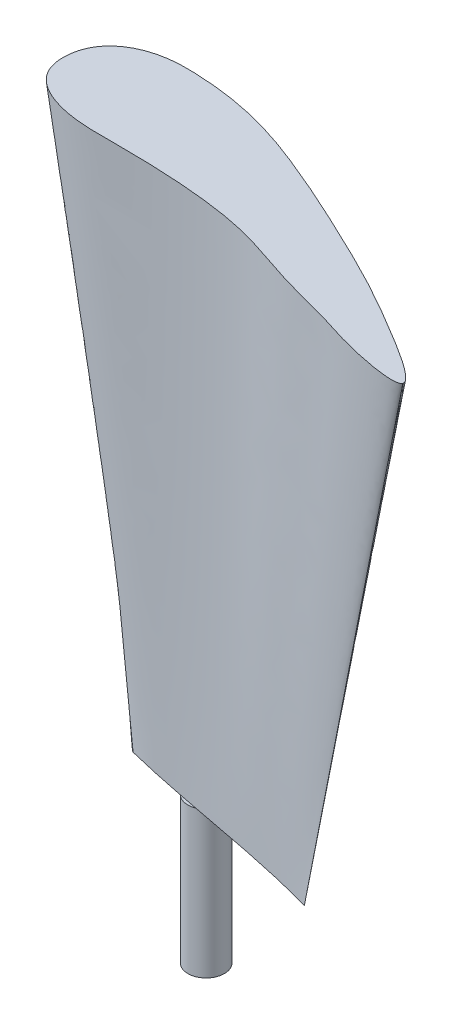
from build123d import *

# Parameters (mm, degrees)
SKETCH1_R           = 0.5
BOSS_EXTRUDE1_DEPTH = 4


with BuildPart() as part:
    # Sketch1 → Boss-Extrude1 (new body)
    with BuildSketch(Plane(origin=(0, 0, 0), x_dir=(1, 0, 0), z_dir=(0, 1, 0))):
        with Locations(Location((0, 0, 0), (0, 0, 270))):
            Circle(SKETCH1_R)
    extrude(amount=BOSS_EXTRUDE1_DEPTH)

    # Loft1: read off the stored shape, not the designer's step
    # Loft1: loft between two sections, ruled curve by curve
    loft1_from = [
        Edge.make_bspline([(3.982375398, 4, 1.293952205), (3.778342255, 4, 1.041167834), (3.35743147, 4, 0.747073774), (2.774835702, 4, 0.481725971), (2.388912903, 4, 0.307417574), (1.943119665, 4, 0.114072033), (1.491029323, 4, -0.05934005), (0.918025904, 4, -0.291830044), (0.582544384, 4, -0.445572937), (0.091107981, 4, -0.648252812), (-0.215529223, 4, -0.758866155), (-0.712050383, 4, -0.892823244), (-1.051235123, 4, -0.958457066), (-1.583065933, 4, -1.00758396), (-1.864928757, 4, -0.950412973), (-2.177884928, 4, -0.708144109), (-2.327212912, 4, -0.335223441), (-2.097184928, 4, -0.059033354), (-2, 4, 0)], [0, 0, 0, 0, 0.126695771, 0.206989258, 0.254842699, 0.296675286, 0.40244821, 0.449001509, 0.545040751, 0.551021467, 0.66150331, 0.674317156, 0.759992592, 0.804387527, 0.871243058, 0.872553131, 0.965343615, 1, 1, 1, 1], 3),
        Edge.make_bspline([(-2, 4, 0), (-1.898005082, 4, 0.025463399), (-1.598012325, 4, 0.098239141), (-1.082098728, 4, 0.213990908), (-0.305813383, 4, 0.373809131), (0.518693331, 4, 0.530338625), (1.38750976, 4, 0.695180106), (2.080405352, 4, 0.833106398), (2.710695257, 4, 0.969417149), (3.313517993, 4, 1.111722031), (3.735710336, 4, 1.223446834), (3.974512186, 4, 1.291699256), (3.982375398, 4, 1.293952205)], [0, 0, 0, 0, 0.051489964, 0.151232112, 0.259137033, 0.439966352, 0.562511328, 0.692507299, 0.786234451, 0.878581378, 0.996001399, 1, 1, 1, 1], 3),
    ]
    loft1_to = [
        Edge.make_bspline([(7.945912088, 19, 2.558825735), (7.999326678, 19, 2.379766219), (6.586617231, 19, 1.514362157), (5.583308433, 19, 0.929295889), (4.970659737, 19, 0.599281473), (4.193046499, 19, 0.202001465), (3.341628587, 19, -0.206134907), (2.283698675, 19, -0.693976723), (1.657446394, 19, -0.966026664), (0.745558302, 19, -1.333617961), (0.178585745, 19, -1.542245386), (-0.764999991, 19, -1.784056092), (-1.423521481, 19, -1.897535409), (-2.337702573, 19, -1.96274037), (-2.858978808, 19, -1.956236967), (-3.606715655, 19, -1.786802244), (-4.20333017, 19, -1.473764254), (-4.400691171, 19, -0.863287732), (-4.422732973, 19, -0.693782032)], [0, 0, 0, 0, 0.126695771, 0.206989258, 0.254842699, 0.296675286, 0.40244821, 0.449001509, 0.545040751, 0.551021467, 0.66150331, 0.674317156, 0.759992592, 0.804387527, 0.871243058, 0.872553131, 0.965343615, 1, 1, 1, 1], 3),
        Edge.make_bspline([(-4.422732973, 19, -0.693782032), (-4.454247575, 19, -0.451428682), (-4.356921525, 19, 0.281406104), (-3.124219807, 19, 0.833691628), (-1.42226489, 19, 0.797143302), (0.430553453, 19, 0.848586825), (2.360686602, 19, 1.14455408), (3.788192091, 19, 1.717620789), (5.223115534, 19, 2.036792165), (6.310537615, 19, 2.445358722), (7.869311301, 19, 2.719580004), (7.944289787, 19, 2.564264106), (7.945912088, 19, 2.558825735)], [0, 0, 0, 0, 0.051489964, 0.151232112, 0.259137033, 0.439966352, 0.562511328, 0.692507299, 0.786234451, 0.878581378, 0.996001399, 1, 1, 1, 1], 3),
    ]
    loft1 = Solid(Shell([*[Face.make_surface_from_curves(loft1_from[k], loft1_to[k]) for k in range(2)], Face(Wire(loft1_from)), Face(Wire(loft1_to))]))
    add(loft1)


solid = part.part
